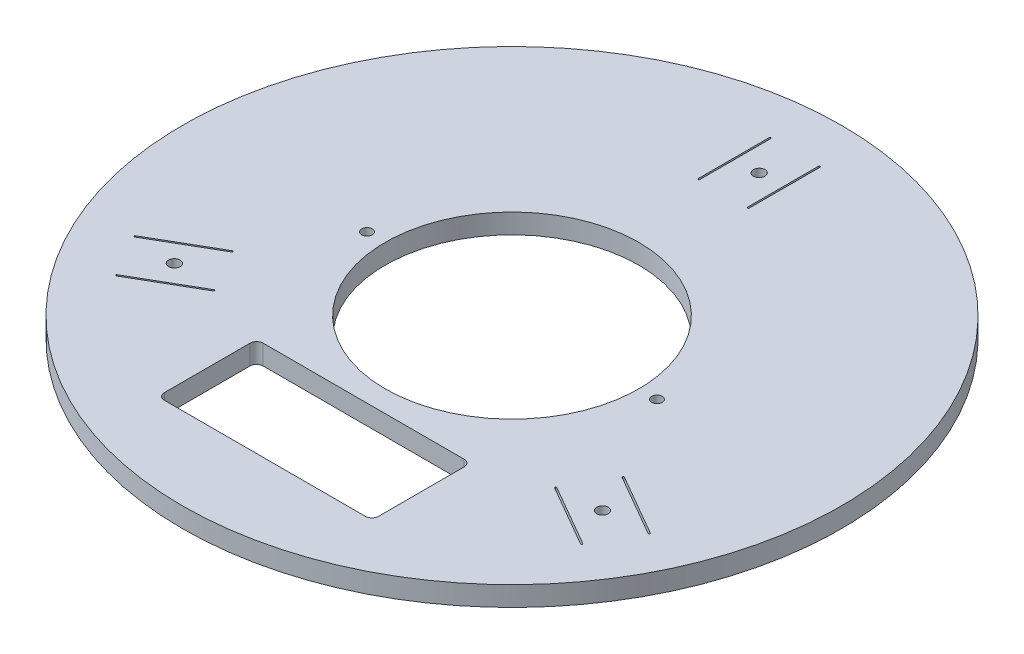
from build123d import *

# Parameters (mm, degrees)
SKETCH2_R           = 100
BOSS_EXTRUDE1_DEPTH = 6
SKETCH3_R           = 1.75
SKETCH3_W           = 0.5
SKETCH3_H           = 22
CUT_EXTRUDE1_DEPTH  = 142.548578234
SKETCH4_R           = 38.5
CUT_EXTRUDE2_DEPTH  = 142.548578234
SKETCH5_R           = 1.6
CUT_EXTRUDE3_DEPTH  = 142.548578234
SKETCH6_W           = 65
SKETCH6_H           = 30
CUT_EXTRUDE4_DEPTH  = 142.548578234
FILLET1_R           = 2
FILLET2_R           = 0.2


with BuildPart() as part:
    # Sketch2 → Boss-Extrude1 (new body)
    with BuildSketch(Plane(origin=(0, 0, 0), x_dir=(1, 0, 0), z_dir=(0, 1, 0))):
        Circle(SKETCH2_R)
    extrude(amount=BOSS_EXTRUDE1_DEPTH)

    # Sketch3 → Cut-Extrude1 (cut, through all)
    with BuildSketch(Plane(origin=(0, 6, 0), x_dir=(1, 0, 0), z_dir=(0, 1, 0))):
        with Locations((0, 75)):
            Circle(SKETCH3_R)
        with Locations((64.951905284, -37.5)):
            Circle(SKETCH3_R)
        with Locations((-64.951905284, -37.5)):
            Circle(SKETCH3_R)
        with Locations((-7.5, 75)):
            Rectangle(SKETCH3_W, SKETCH3_H)
        with Locations((7.5, 75)):
            Rectangle(SKETCH3_W, SKETCH3_H)
        Polygon((59.300625842, -25.288303121), (78.353184725, -36.288303121), (78.103184725, -36.721315823), (59.050625842, -25.721315823), align=None)
        Polygon((51.800625842, -38.278684177), (70.853184725, -49.278684177), (70.603184725, -49.711696879), (51.550625842, -38.711696879), align=None)
        Polygon((-51.550625842, -38.711696879), (-70.603184725, -49.711696879), (-70.853184725, -49.278684177), (-51.800625842, -38.278684177), align=None)
        Polygon((-59.050625842, -25.721315823), (-78.103184725, -36.721315823), (-78.353184725, -36.288303121), (-59.300625842, -25.288303121), align=None)
    extrude(amount=-CUT_EXTRUDE1_DEPTH, mode=Mode.SUBTRACT)

    # Sketch4 → Cut-Extrude2 (cut, through all)
    with BuildSketch(Plane(origin=(0, 6, 0), x_dir=(1, 0, 0), z_dir=(0, 1, 0))):
        Circle(SKETCH4_R)
    extrude(amount=-CUT_EXTRUDE2_DEPTH, mode=Mode.SUBTRACT)

    # Sketch5 → Cut-Extrude3 (cut, through all)
    with BuildSketch(Plane(origin=(0, 6, 0), x_dir=(1, 0, 0), z_dir=(0, 1, 0))):
        with Locations((-44, 0)):
            Circle(SKETCH5_R)
        with Locations((44, 0)):
            Circle(SKETCH5_R)
    extrude(amount=-CUT_EXTRUDE3_DEPTH, mode=Mode.SUBTRACT)

    # Sketch6 → Cut-Extrude4 (cut, through all)
    with BuildSketch(Plane(origin=(0, 6, 0), x_dir=(1, 0, 0), z_dir=(0, 1, 0))):
        with Locations((0, -60)):
            Rectangle(SKETCH6_W, SKETCH6_H)
    extrude(amount=-CUT_EXTRUDE4_DEPTH, mode=Mode.SUBTRACT)

    # Fillet1
    fillet1_edges = [part.edges().sort_by_distance(p)[0] for p in [
        (32.5, 3, 45),
        (32.5, 3, 75),
        (-32.5, 3, 75),
        (-32.5, 3, 45),
    ]]
    fillet(fillet1_edges, radius=FILLET1_R)

    # Fillet2
    fillet2_edges = [part.edges().sort_by_distance(p)[0] for p in [
        (-7.75, 3, -64),
        (-7.75, 3, -86),
        (-7.25, 3, -86),
        (-7.25, 3, -64),
        (-51.550625842, 3, 38.711696879),
        (-70.603184725, 3, 49.711696879),
        (-70.853184725, 3, 49.278684177),
        (-59.300625842, 3, 25.288303121),
        (-59.050625842, 3, 25.721315823),
        (-78.103184725, 3, 36.721315823),
        (-78.353184725, 3, 36.288303121),
        (51.550625842, 3, 38.711696879),
        (51.800625842, 3, 38.278684177),
        (70.853184725, 3, 49.278684177),
        (70.603184725, 3, 49.711696879),
        (59.050625842, 3, 25.721315823),
        (59.300625842, 3, 25.288303121),
        (78.353184725, 3, 36.288303121),
        (78.103184725, 3, 36.721315823),
        (7.25, 3, -64),
        (7.25, 3, -86),
        (7.75, 3, -86),
        (7.75, 3, -64),
        (-51.800625842, 3, 38.278684177),
    ]]
    fillet(fillet2_edges, radius=FILLET2_R)


solid = part.part
